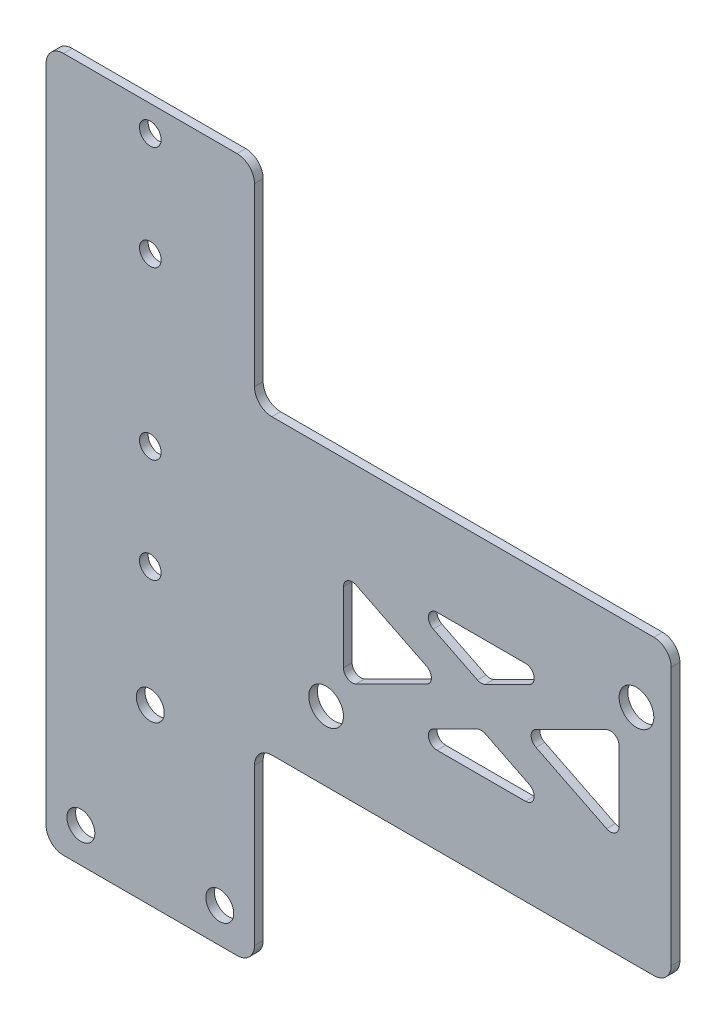
from build123d import *

# Parameters (mm, degrees)
SKETCH1_R           = 3.175
BOSS_EXTRUDE1_DEPTH = 0.79375
SKETCH2_R           = 2.5527
SKETCH2_R_2         = 1.9812
CUT_EXTRUDE1_DEPTH  = 115.487259799
FILLET1_R           = 3.175
CUT_EXTRUDE2_DEPTH  = 115.487259799
FILLET2_R           = 1.5875


with BuildPart() as part:
    # Sketch1 → Boss-Extrude1 (new, symmetric)
    with BuildSketch(Plane.XY):
        Polygon((19.05, 63.5), (-19.05, 63.5), (-19.05, -63.5), (19.05, -63.5), (19.05, -28.575), (95.25, -28.575), (95.25, 25.019), (19.05, 25.019), align=None)
        with Locations((88.9, 12.319)):
            Circle(SKETCH1_R, mode=Mode.SUBTRACT)
        with Locations((32.1437, -15.875)):
            Circle(SKETCH1_R, mode=Mode.SUBTRACT)
    extrude(amount=BOSS_EXTRUDE1_DEPTH, both=True)

    # Sketch2 → Cut-Extrude1 (cut, through all)
    with BuildSketch(Plane.XY.offset(0.79375)):
        with Locations((-12.7, -57.15)):
            Circle(SKETCH2_R)
        with Locations((12.7, -57.15)):
            Circle(SKETCH2_R)
        with Locations((0, -31.75)):
            Circle(SKETCH2_R)
        with Locations((0, -9.8425)):
            Circle(SKETCH2_R_2)
        with Locations((0, 9.2075)):
            Circle(SKETCH2_R_2)
        with Locations((0, 39.6875)):
            Circle(SKETCH2_R_2)
        with Locations((0, 58.7375)):
            Circle(SKETCH2_R_2)
    extrude(amount=-CUT_EXTRUDE1_DEPTH, mode=Mode.SUBTRACT)

    # Fillet1
    fillet1_edges = [part.edges().sort_by_distance(p)[0] for p in [
        (95.25, -28.575, 0),
        (19.05, -28.575, 0),
        (19.05, -63.5, 0),
        (-19.05, -63.5, 0),
        (-19.05, 63.5, 0),
        (19.05, 63.5, 0),
        (95.25, 25.019, 0),
        (19.05, 25.019, 0),
    ]]
    fillet(fillet1_edges, radius=FILLET1_R)

    # Sketch3 → Cut-Extrude2 (cut, through all)
    with BuildSketch(Plane.XY.offset(0.79375)):
        Polygon((60.52185, -5.323162907), (45.671811727, -12.7), (75.371888273, -12.7), align=None)
        Polygon((35.3187, 7.196638614), (35.3187, -10.752638614), (53.385213498, -1.778), align=None)
        Polygon((85.725, 7.196638614), (67.658486502, -1.778), (85.725, -10.752638614), align=None)
        Polygon((45.671811727, 9.144), (60.52185, 1.767162907), (75.371888273, 9.144), align=None)
    extrude(amount=-CUT_EXTRUDE2_DEPTH, mode=Mode.SUBTRACT)

    # Fillet2
    fillet2_edges = [part.edges().sort_by_distance(p)[0] for p in [
        (60.52185, -5.323162907, 0),
        (75.371888273, -12.7, 0),
        (75.371888273, 9.144, 0),
        (45.671811727, 9.144, 0),
        (60.52185, 1.767162907, 0),
        (85.725, 7.196638614, 0),
        (85.725, -10.752638614, 0),
        (67.658486502, -1.778, 0),
        (45.671811727, -12.7, 0),
        (53.385213498, -1.778, 0),
        (35.3187, 7.196638614, 0),
        (35.3187, -10.752638614, 0),
    ]]
    fillet(fillet2_edges, radius=FILLET2_R)


solid = part.part
